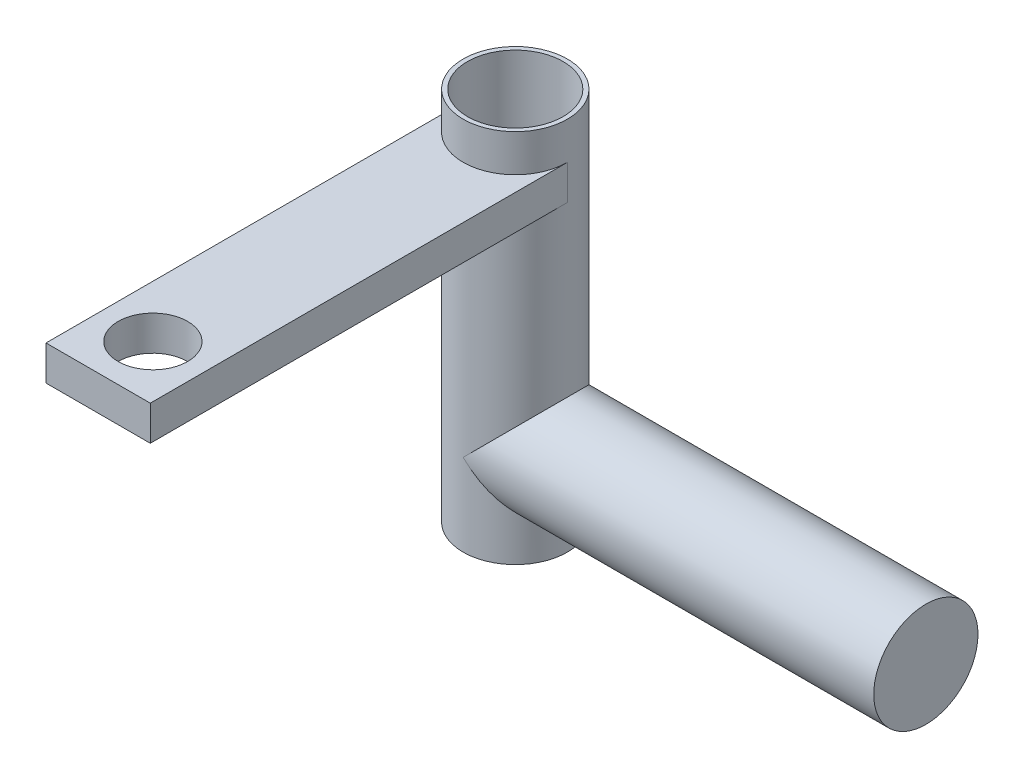
from build123d import *

# Parameters (mm, degrees)
SLEEVE_DEPTH       = 63.5
SLEEVE_DEPTH_BACK  = 5
SKETCH1_R          = 9.525
SKETCH2_W          = 19.05
SKETCH2_H          = 6.35
BRACKET_DEPTH      = 76.2
SKETCH4_R          = 6.35
BRACKET_HOLE_DEPTH = 100.646453148
SKETCH5_R          = 9.525
SHAFT_DEPTH        = 75
SKETCH6_R          = 8.73125
SLEEVE_HOLE_DEPTH  = 125.353086009


with BuildPart() as part:
    # Sketch1 → Sleeve (new, two sides: drawn at the far end of the back side and taken through both)
    with BuildSketch(Plane(origin=(0, 0, 0), x_dir=(1, 0, 0), z_dir=(0, 1, 0)).offset(-SLEEVE_DEPTH_BACK)):
        Circle(SKETCH1_R)
    extrude(amount=SLEEVE_DEPTH + SLEEVE_DEPTH_BACK)

    # Sketch2 → Bracket (add)
    with BuildSketch(Plane.XY):
        with Locations((0, 53.5)):
            Rectangle(SKETCH2_W, SKETCH2_H)
    extrude(amount=BRACKET_DEPTH)

    # Sketch4 → Bracket Hole (cut, through all)
    with BuildSketch(Plane(origin=(0, 0, 0), x_dir=(1, 0, 0), z_dir=(0, 1, 0))):
        with Locations((0, -66.2)):
            Circle(SKETCH4_R)
    extrude(amount=BRACKET_HOLE_DEPTH, mode=Mode.SUBTRACT)

    # Sketch5 → Shaft (add)
    with BuildSketch(Plane(origin=(0, 0, 0), x_dir=(0, 0, -1), z_dir=(1, 0, 0))):
        with Locations((0, 10)):
            Circle(SKETCH5_R)
    extrude(amount=SHAFT_DEPTH)

    # Sketch6 → Sleeve Hole (cut, through all)
    with BuildSketch(Plane(origin=(0, 0, 0), x_dir=(1, 0, 0), z_dir=(0, 1, 0))):
        Circle(SKETCH6_R)
    extrude(amount=SLEEVE_HOLE_DEPTH, mode=Mode.SUBTRACT)


solid = part.part
